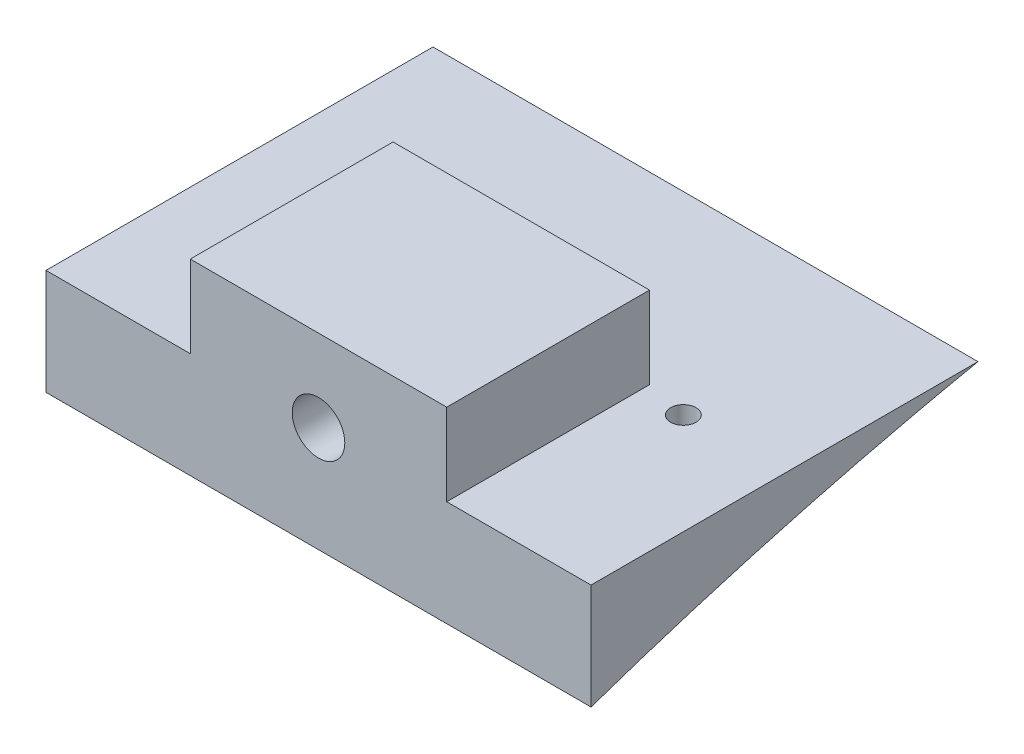
from build123d import *

# Parameters (mm, degrees)
BOSS_EXTRUDE1_DEPTH = 68.2625
SKETCH2_R           = 3.175
CUT_EXTRUDE1_DEPTH  = 364.143790643
SKETCH4_W           = 64.246369732
SKETCH4_H           = 20.526706846
BOSS_EXTRUDE2_DEPTH = 50.8
SKETCH5_R           = 6.582805395
CUT_EXTRUDE2_DEPTH  = 12.7


with BuildPart() as part:
    # Sketch1 → Boss-Extrude1 (new, symmetric)
    with BuildSketch(Plane(origin=(0, 0, 0), x_dir=(0, 0, -1), z_dir=(1, 0, 0))):
        with BuildLine():
            Line((-258.749759613, 26.462577976), (-355.687187923, 26.462577976))
            Line((-355.687187923, 26.462577976), (-355.687187923, 0))
            add(Edge.make_bspline(
                [(-355.687187923, 0), (-355.37055154, 0.107976188), (-354.108976481, 0.538185956), (-351.284999827, 1.502859463), (-346.602313416, 3.058862652), (-336.815361237, 6.25189344), (-320.429894612, 11.27779725), (-301.357119069, 16.549630187), (-283.167308194, 21.086195797), (-270.107851124, 24.071552001), (-261.828911243, 25.828285388), (-258.749759613, 26.462577976)],
                knots=[0, 0, 0, 0, 0.001371577, 0.005464776, 0.012234802, 0.021601969, 0.04767125, 0.082496261, 0.102719149, 0.124527079, 0.137415965, 0.137415965, 0.137415965, 0.137415965], degree=3))
        make_face()
    extrude(amount=BOSS_EXTRUDE1_DEPTH, both=True)

    # Sketch2 → Cut-Extrude1 (cut, through all)
    with BuildSketch(Plane(origin=(0, 26.462577976, 0), x_dir=(1, 0, 0), z_dir=(0, 1, 0))):
        with Locations((-42.926, -307.218473768)):
            Circle(SKETCH2_R)
        with Locations((42.926, -307.218473768)):
            Circle(SKETCH2_R)
    extrude(amount=-CUT_EXTRUDE1_DEPTH, mode=Mode.SUBTRACT)

    # Sketch4 → Boss-Extrude2 (add)
    with BuildSketch(Plane.XY.offset(355.687187923)):
        with Locations((0, 36.725931399)):
            Rectangle(SKETCH4_W, SKETCH4_H)
    extrude(amount=-BOSS_EXTRUDE2_DEPTH)

    # Sketch5 → Cut-Extrude2 (cut)
    with BuildSketch(Plane.XY.offset(355.687187923)):
        with Locations((0, 26.462577976)):
            Circle(SKETCH5_R)
    extrude(amount=-CUT_EXTRUDE2_DEPTH, mode=Mode.SUBTRACT)


solid = part.part
